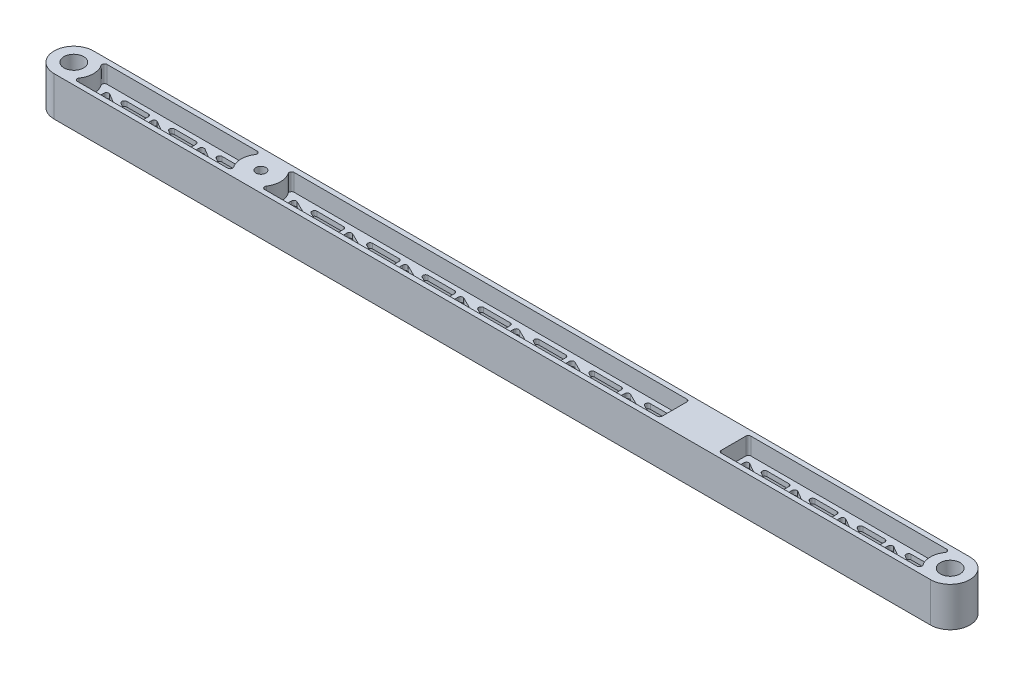
from build123d import *

# Parameters (mm, degrees)
SKETCH2_R           = 6.35
SKETCH2_R_2         = 3.175
BOSS_EXTRUDE1_DEPTH = 25.4
CUT_EXTRUDE2_DEPTH  = 579.965406998
CUT_EXTRUDE3_START  = -11.1125
CUT_EXTRUDE3_DEPTH  = 11.1125
FILLET1_R           = 1.5875


with BuildPart() as part:
    # Sketch2 → Boss-Extrude1 (new body)
    with BuildSketch(Plane(origin=(0, 0, 0), x_dir=(1, 0, 0), z_dir=(0, 1, 0))):
        with BuildLine():
            ThreePointArc((0, 25.4), (-12.7, 12.7), (0, 0))
            Line((0, 0), (565.15, 0))
            ThreePointArc((565.15, 0), (577.85, 12.7), (565.15, 25.4))
            Line((565.15, 25.4), (0, 25.4))
        make_face()
        with Locations((0, 12.7)):
            Circle(SKETCH2_R, mode=Mode.SUBTRACT)
        with Locations((120.65, 12.7)):
            Circle(SKETCH2_R_2, mode=Mode.SUBTRACT)
        with Locations((565.15, 12.7)):
            Circle(SKETCH2_R, mode=Mode.SUBTRACT)
    extrude(amount=BOSS_EXTRUDE1_DEPTH)

    # Sketch13 → Cut-Extrude2 (cut, through all)
    with BuildSketch(Plane(origin=(0, 25.4, 0), x_dir=(1, 0, 0), z_dir=(0, 1, 0))):
        Polygon((37.188969245, 6.35), (15.875, 19.05), (15.875, 6.35), align=None)
        Polygon((43.391666667, 19.05), (22.077697422, 19.05), (43.391666667, 6.35), align=None)
        Polygon((67.880635911, 6.35), (46.566666667, 19.05), (46.566666667, 6.35), align=None)
        Polygon((74.083333333, 19.05), (52.769364089, 19.05), (74.083333333, 6.35), align=None)
        Polygon((98.572302578, 6.35), (77.258333333, 19.05), (77.258333333, 6.35), align=None)
        Polygon((104.775, 19.05), (83.461030755, 19.05), (104.775, 6.35), align=None)
        Polygon((162.053809746, 6.35), (136.525, 19.05), (136.525, 6.35), align=None)
        Polygon((169.182142857, 19.05), (143.653333111, 19.05), (169.182142857, 6.35), align=None)
        Polygon((197.885952603, 6.35), (172.357142857, 19.05), (172.357142857, 6.35), align=None)
        Polygon((205.014285714, 19.05), (179.485475968, 19.05), (205.014285714, 6.35), align=None)
        Polygon((233.71809546, 6.35), (208.189285714, 19.05), (208.189285714, 6.35), align=None)
        Polygon((240.846428571, 19.05), (215.317618825, 19.05), (240.846428571, 6.35), align=None)
        Polygon((269.550238318, 6.35), (244.021428571, 19.05), (244.021428571, 6.35), align=None)
        Polygon((276.678571429, 19.05), (251.149761682, 19.05), (276.678571429, 6.35), align=None)
        Polygon((305.382381175, 6.35), (279.853571429, 19.05), (279.853571429, 6.35), align=None)
        Polygon((312.510714286, 19.05), (286.98190454, 19.05), (312.510714286, 6.35), align=None)
        Polygon((341.214524032, 6.35), (315.685714286, 19.05), (315.685714286, 6.35), align=None)
        Polygon((348.342857143, 19.05), (322.814047397, 19.05), (348.342857143, 6.35), align=None)
        Polygon((377.046666889, 6.35), (351.517857143, 19.05), (351.517857143, 6.35), align=None)
        Polygon((384.175, 19.05), (358.646190254, 19.05), (384.175, 6.35), align=None)
        Polygon((450.156724268, 6.35), (428.625, 19.05), (428.625, 6.35), align=None)
        Polygon((456.40625, 19.05), (434.874525732, 19.05), (456.40625, 6.35), align=None)
        Polygon((481.112974268, 6.35), (459.58125, 19.05), (459.58125, 6.35), align=None)
        Polygon((487.3625, 19.05), (465.830775732, 19.05), (487.3625, 6.35), align=None)
        Polygon((512.069224268, 6.35), (490.5375, 19.05), (490.5375, 6.35), align=None)
        Polygon((518.31875, 19.05), (496.787025732, 19.05), (518.31875, 6.35), align=None)
        Polygon((543.025474268, 6.35), (521.49375, 19.05), (521.49375, 6.35), align=None)
        Polygon((549.275, 19.05), (527.743275732, 19.05), (549.275, 6.35), align=None)
    extrude(amount=-CUT_EXTRUDE2_DEPTH, mode=Mode.SUBTRACT)

    # Sketch13<4> → Cut-Extrude3 (cut)
    # profile 1 of 3: a face of its own
    with BuildSketch(Plane(origin=(0, 25.4, 0), x_dir=(1, 0, 0), z_dir=(0, 1, 0)).offset(CUT_EXTRUDE3_START)):
        with BuildLine():
            ThreePointArc((556.749739587, 3.175), (552.45, 12.7), (556.749739587, 22.225))
            Line((556.749739587, 22.225), (425.45, 22.225))
            Line((425.45, 22.225), (425.45, 3.175))
            Line((425.45, 3.175), (556.749739587, 3.175))
        make_face()
        Polygon((428.625, 6.35), (428.625, 19.05), (450.156724268, 6.35), align=None, mode=Mode.SUBTRACT)
        Polygon((456.40625, 6.35), (434.874525732, 19.05), (456.40625, 19.05), align=None, mode=Mode.SUBTRACT)
        Polygon((459.58125, 6.35), (459.58125, 19.05), (481.112974268, 6.35), align=None, mode=Mode.SUBTRACT)
        Polygon((487.3625, 6.35), (465.830775732, 19.05), (487.3625, 19.05), align=None, mode=Mode.SUBTRACT)
        Polygon((490.5375, 6.35), (490.5375, 19.05), (512.069224268, 6.35), align=None, mode=Mode.SUBTRACT)
        Polygon((518.31875, 6.35), (496.787025732, 19.05), (518.31875, 19.05), align=None, mode=Mode.SUBTRACT)
        Polygon((521.49375, 6.35), (521.49375, 19.05), (543.025474268, 6.35), align=None, mode=Mode.SUBTRACT)
        Polygon((549.275, 6.35), (527.743275732, 19.05), (549.275, 19.05), align=None, mode=Mode.SUBTRACT)
    # profile 2 of 3: a face of its own
    with BuildSketch(Plane(origin=(0, 25.4, 0), x_dir=(1, 0, 0), z_dir=(0, 1, 0)).offset(CUT_EXTRUDE3_START)):
        with BuildLine():
            Line((387.35, 3.175), (387.35, 22.225))
            Line((387.35, 22.225), (129.050260413, 22.225))
            ThreePointArc((129.050260413, 22.225), (133.35, 12.7), (129.050260413, 3.175))
            Line((129.050260413, 3.175), (387.35, 3.175))
        make_face()
        Polygon((136.525, 6.35), (136.525, 19.05), (162.053809746, 6.35), align=None, mode=Mode.SUBTRACT)
        Polygon((169.182142857, 6.35), (143.653333111, 19.05), (169.182142857, 19.05), align=None, mode=Mode.SUBTRACT)
        Polygon((172.357142857, 6.35), (172.357142857, 19.05), (197.885952603, 6.35), align=None, mode=Mode.SUBTRACT)
        Polygon((205.014285714, 6.35), (179.485475968, 19.05), (205.014285714, 19.05), align=None, mode=Mode.SUBTRACT)
        Polygon((208.189285714, 6.35), (208.189285714, 19.05), (233.71809546, 6.35), align=None, mode=Mode.SUBTRACT)
        Polygon((240.846428571, 6.35), (215.317618825, 19.05), (240.846428571, 19.05), align=None, mode=Mode.SUBTRACT)
        Polygon((244.021428571, 6.35), (244.021428571, 19.05), (269.550238318, 6.35), align=None, mode=Mode.SUBTRACT)
        Polygon((276.678571429, 6.35), (251.149761682, 19.05), (276.678571429, 19.05), align=None, mode=Mode.SUBTRACT)
        Polygon((279.853571429, 6.35), (279.853571429, 19.05), (305.382381175, 6.35), align=None, mode=Mode.SUBTRACT)
        Polygon((312.510714286, 6.35), (286.98190454, 19.05), (312.510714286, 19.05), align=None, mode=Mode.SUBTRACT)
        Polygon((315.685714286, 6.35), (315.685714286, 19.05), (341.214524032, 6.35), align=None, mode=Mode.SUBTRACT)
        Polygon((348.342857143, 6.35), (322.814047397, 19.05), (348.342857143, 19.05), align=None, mode=Mode.SUBTRACT)
        Polygon((351.517857143, 6.35), (351.517857143, 19.05), (377.046666889, 6.35), align=None, mode=Mode.SUBTRACT)
        Polygon((384.175, 6.35), (358.646190254, 19.05), (384.175, 19.05), align=None, mode=Mode.SUBTRACT)
    # profile 3 of 3: a face of its own
    with BuildSketch(Plane(origin=(0, 25.4, 0), x_dir=(1, 0, 0), z_dir=(0, 1, 0)).offset(CUT_EXTRUDE3_START)):
        with BuildLine():
            ThreePointArc((112.249739587, 3.175), (107.95, 12.7), (112.249739587, 22.225))
            Line((112.249739587, 22.225), (8.400260413, 22.225))
            ThreePointArc((8.400260413, 22.225), (12.7, 12.7), (8.400260413, 3.175))
            Line((8.400260413, 3.175), (112.249739587, 3.175))
        make_face()
        Polygon((15.875, 6.35), (15.875, 19.05), (37.188969245, 6.35), align=None, mode=Mode.SUBTRACT)
        Polygon((43.391666667, 6.35), (22.077697422, 19.05), (43.391666667, 19.05), align=None, mode=Mode.SUBTRACT)
        Polygon((46.566666667, 6.35), (46.566666667, 19.05), (67.880635911, 6.35), align=None, mode=Mode.SUBTRACT)
        Polygon((74.083333333, 6.35), (52.769364089, 19.05), (74.083333333, 19.05), align=None, mode=Mode.SUBTRACT)
        Polygon((77.258333333, 6.35), (77.258333333, 19.05), (98.572302578, 6.35), align=None, mode=Mode.SUBTRACT)
        Polygon((104.775, 6.35), (83.461030755, 19.05), (104.775, 19.05), align=None, mode=Mode.SUBTRACT)
    cut_extrude3 = extrude(amount=CUT_EXTRUDE3_DEPTH, mode=Mode.SUBTRACT)

    # Mirror1: Cut-Extrude3 across plane
    add(cut_extrude3.mirror(Plane(origin=(0, 12.7, 0), x_dir=(0, 0, 1), z_dir=(0, -1, 0))), mode=Mode.SUBTRACT)

    # Fillet1
    fillet1_edges = [part.edges().sort_by_distance(p)[0] for p in [
        (104.775, 12.7, -19.05),
        (83.461030755, 12.7, -19.05),
        (98.572302578, 12.7, -6.35),
        (77.258333333, 12.7, -6.35),
        (77.258333333, 12.7, -19.05),
        (74.083333333, 12.7, -19.05),
        (74.083333333, 12.7, -6.35),
        (52.769364089, 12.7, -19.05),
        (67.880635911, 12.7, -6.35),
        (46.566666667, 12.7, -6.35),
        (46.566666667, 12.7, -19.05),
        (43.391666667, 12.7, -19.05),
        (43.391666667, 12.7, -6.35),
        (22.077697422, 12.7, -19.05),
        (37.188969245, 12.7, -6.35),
        (15.875, 12.7, -6.35),
        (15.875, 12.7, -19.05),
        (104.775, 12.7, -6.35),
        (384.175, 12.7, -19.05),
        (358.646190254, 12.7, -19.05),
        (377.046666889, 12.7, -6.35),
        (351.517857143, 12.7, -6.35),
        (351.517857143, 12.7, -19.05),
        (348.342857143, 12.7, -19.05),
        (348.342857143, 12.7, -6.35),
        (322.814047397, 12.7, -19.05),
        (341.214524032, 12.7, -6.35),
        (315.685714286, 12.7, -6.35),
        (315.685714286, 12.7, -19.05),
        (312.510714286, 12.7, -19.05),
        (312.510714286, 12.7, -6.35),
        (286.98190454, 12.7, -19.05),
        (305.382381175, 12.7, -6.35),
        (279.853571429, 12.7, -6.35),
        (279.853571429, 12.7, -19.05),
        (276.678571429, 12.7, -19.05),
        (276.678571429, 12.7, -6.35),
        (251.149761682, 12.7, -19.05),
        (269.550238318, 12.7, -6.35),
        (244.021428571, 12.7, -6.35),
        (244.021428571, 12.7, -19.05),
        (240.846428571, 12.7, -19.05),
        (240.846428571, 12.7, -6.35),
        (215.317618825, 12.7, -19.05),
        (233.71809546, 12.7, -6.35),
        (208.189285714, 12.7, -6.35),
        (208.189285714, 12.7, -19.05),
        (205.014285714, 12.7, -19.05),
        (205.014285714, 12.7, -6.35),
        (179.485475968, 12.7, -19.05),
        (197.885952603, 12.7, -6.35),
        (172.357142857, 12.7, -6.35),
        (172.357142857, 12.7, -19.05),
        (169.182142857, 12.7, -19.05),
        (169.182142857, 12.7, -6.35),
        (143.653333111, 12.7, -19.05),
        (162.053809746, 12.7, -6.35),
        (136.525, 12.7, -6.35),
        (136.525, 12.7, -19.05),
        (384.175, 12.7, -6.35),
        (112.249739587, 5.55625, -22.225),
        (112.249739587, 5.55625, -3.175),
        (8.400260413, 5.55625, -3.175),
        (8.400260413, 5.55625, -22.225),
        (387.35, 5.55625, -22.225),
        (129.050260413, 5.55625, -3.175),
        (129.050260413, 5.55625, -22.225),
        (387.35, 5.55625, -3.175),
        (425.45, 19.84375, -22.225),
        (425.45, 19.84375, -3.175),
        (556.749739587, 19.84375, -3.175),
        (112.249739587, 19.84375, -3.175),
        (112.249739587, 19.84375, -22.225),
        (8.400260413, 19.84375, -22.225),
        (8.400260413, 19.84375, -3.175),
        (387.35, 19.84375, -3.175),
        (387.35, 19.84375, -22.225),
        (129.050260413, 19.84375, -22.225),
        (129.050260413, 19.84375, -3.175),
        (556.749739587, 19.84375, -22.225),
        (549.275, 12.7, -6.35),
        (527.743275732, 12.7, -19.05),
        (543.025474268, 12.7, -6.35),
        (521.49375, 12.7, -6.35),
        (521.49375, 12.7, -19.05),
        (518.31875, 12.7, -19.05),
        (518.31875, 12.7, -6.35),
        (496.787025732, 12.7, -19.05),
        (512.069224268, 12.7, -6.35),
        (490.5375, 12.7, -6.35),
        (490.5375, 12.7, -19.05),
        (487.3625, 12.7, -19.05),
        (487.3625, 12.7, -6.35),
        (465.830775732, 12.7, -19.05),
        (481.112974268, 12.7, -6.35),
        (459.58125, 12.7, -6.35),
        (459.58125, 12.7, -19.05),
        (456.40625, 12.7, -19.05),
        (456.40625, 12.7, -6.35),
        (434.874525732, 12.7, -19.05),
        (450.156724268, 12.7, -6.35),
        (428.625, 12.7, -6.35),
        (428.625, 12.7, -19.05),
        (549.275, 12.7, -19.05),
        (556.749739587, 5.55625, -22.225),
        (425.45, 5.55625, -22.225),
        (425.45, 5.55625, -3.175),
        (556.749739587, 5.55625, -3.175),
    ]]
    fillet(fillet1_edges, radius=FILLET1_R)


solid = part.part
